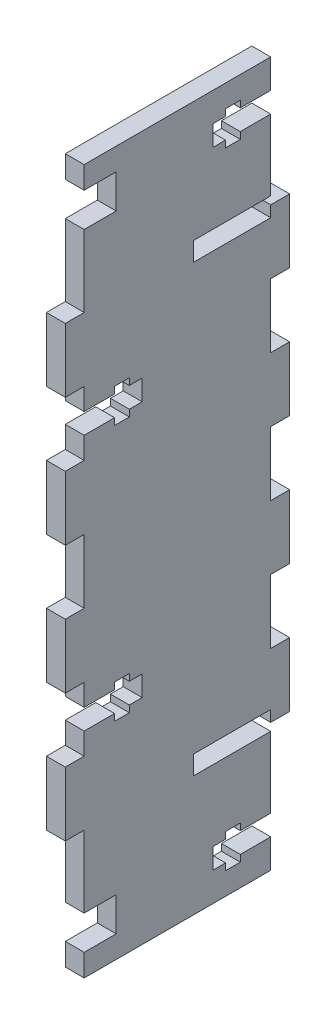
from build123d import *

# Parameters (mm, degrees)
FRONT_START        = 0.495634701
FRONT_PLATE_DEPTH  = 2.95
SKETCH1_W          = 5
SKETCH1_H          = 5.3
CUT_EXTRUDE2_DEPTH = 98.689964927
CUT_EXTRUDE3_START = 2.95
SKETCH3_W          = 3.2
SKETCH3_H          = 3.2
CUT_EXTRUDE3_DEPTH = 12
SKETCH4_W          = 2.3
SKETCH4_H          = 5.3
CUT_EXTRUDE4_DEPTH = 98.689964927


# Read off the part's stored shape, not the designer's step: Front Plate
with BuildPart() as part:
    # Front Plate outline → Front Plate (new body)
    with BuildSketch(Plane.YZ.offset(FRONT_START)):
        Polygon((-18.627257495, 18.295409887), (-7.556257495, 18.295409887), (-7.556257495, 30.360409887), (-4.606257495, 30.360409887), (-4.606257495, 18.295409887), (-6.352257495, 18.295409887), (-6.352257495, 15.345409887), (3.647742505, 15.345409887), (3.647742505, 18.295409887), (13.647742505, 18.295409887), (13.647742505, 15.345409887), (23.647742505, 15.345409887), (23.647742505, 18.295409887), (33.647742505, 18.295409887), (33.647742505, 15.345409887), (43.647742505, 15.345409887), (43.647742505, 18.295409887), (53.647742505, 18.295409887), (53.647742505, 15.345409887), (63.647742505, 15.345409887), (63.647742505, 18.295409887), (61.901742505, 18.295409887), (61.901742505, 30.360409887), (64.851742505, 30.360409887), (64.851742505, 18.295409887), (75.922742505, 18.295409887), (75.922742505, 23.045409887), (74.872742505, 23.045409887), (74.872742505, 25.345409887), (75.922742505, 25.345409887), (75.922742505, 27.345409887), (79.122742505, 27.345409887), (79.122742505, 25.345409887), (80.172742505, 25.345409887), (80.172742505, 23.045409887), (79.122742505, 23.045409887), (79.122742505, 18.295409887), (83.647742505, 18.295409887), (83.647742505, 47.425409887), (63.647742505, 47.425409887), (63.647742505, 50.375409887), (53.647742505, 50.375409887), (53.647742505, 47.425409887), (43.647742505, 47.425409887), (43.647742505, 50.375409887), (33.647742505, 50.375409887), (33.647742505, 47.425409887), (23.647742505, 47.425409887), (23.647742505, 50.375409887), (13.647742505, 50.375409887), (13.647742505, 47.425409887), (3.647742505, 47.425409887), (3.647742505, 50.375409887), (-6.352257495, 50.375409887), (-6.352257495, 47.425409887), (-26.352257495, 47.425409887), (-26.352257495, 18.295409887), (-21.827257495, 18.295409887), (-21.827257495, 23.045409887), (-22.877257495, 23.045409887), (-22.877257495, 25.345409887), (-21.827257495, 25.345409887), (-21.827257495, 27.345409887), (-18.627257495, 27.345409887), (-18.627257495, 25.345409887), (-17.577257495, 25.345409887), (-17.577257495, 23.045409887), (-18.627257495, 23.045409887), align=None)
    extrude(amount=FRONT_PLATE_DEPTH)

    # Sketch1 → Cut-Extrude2 (cut, through all)
    with BuildSketch(Plane(origin=(3.445634701, 0, 0), x_dir=(0, 0, -1), z_dir=(1, 0, 0))):
        with Locations((-44.925409887, -20.227257495)):
            Rectangle(SKETCH1_W, SKETCH1_H)
    cut_extrude2 = extrude(amount=-CUT_EXTRUDE2_DEPTH, mode=Mode.SUBTRACT)

    # Sketch3 → Cut-Extrude3 (cut)
    with BuildSketch(Plane.XY.offset(47.425409887).offset(CUT_EXTRUDE3_START)):
        with Locations((1.970634701, 8.647742505)):
            Rectangle(SKETCH3_W, SKETCH3_H)
    cut_extrude3 = extrude(amount=-CUT_EXTRUDE3_DEPTH, mode=Mode.SUBTRACT)

    # Sketch4 → Cut-Extrude4 (cut, through all)
    with BuildSketch(Plane(origin=(3.445634701, 0, 0), x_dir=(0, 0, -1), z_dir=(1, 0, 0))):
        with Locations((-41.525409887, 8.647742505)):
            Rectangle(SKETCH4_W, SKETCH4_H)
    cut_extrude4 = extrude(amount=-CUT_EXTRUDE4_DEPTH, mode=Mode.SUBTRACT)

    # Mirror1: Cut-Extrude2, Cut-Extrude3, Cut-Extrude4 across plane
    add(cut_extrude2.mirror(Plane.ZX.offset(28.647742505)), mode=Mode.SUBTRACT)
    add(cut_extrude3.mirror(Plane.ZX.offset(28.647742505)), mode=Mode.SUBTRACT)
    add(cut_extrude4.mirror(Plane.ZX.offset(28.647742505)), mode=Mode.SUBTRACT)


solid = part.part
